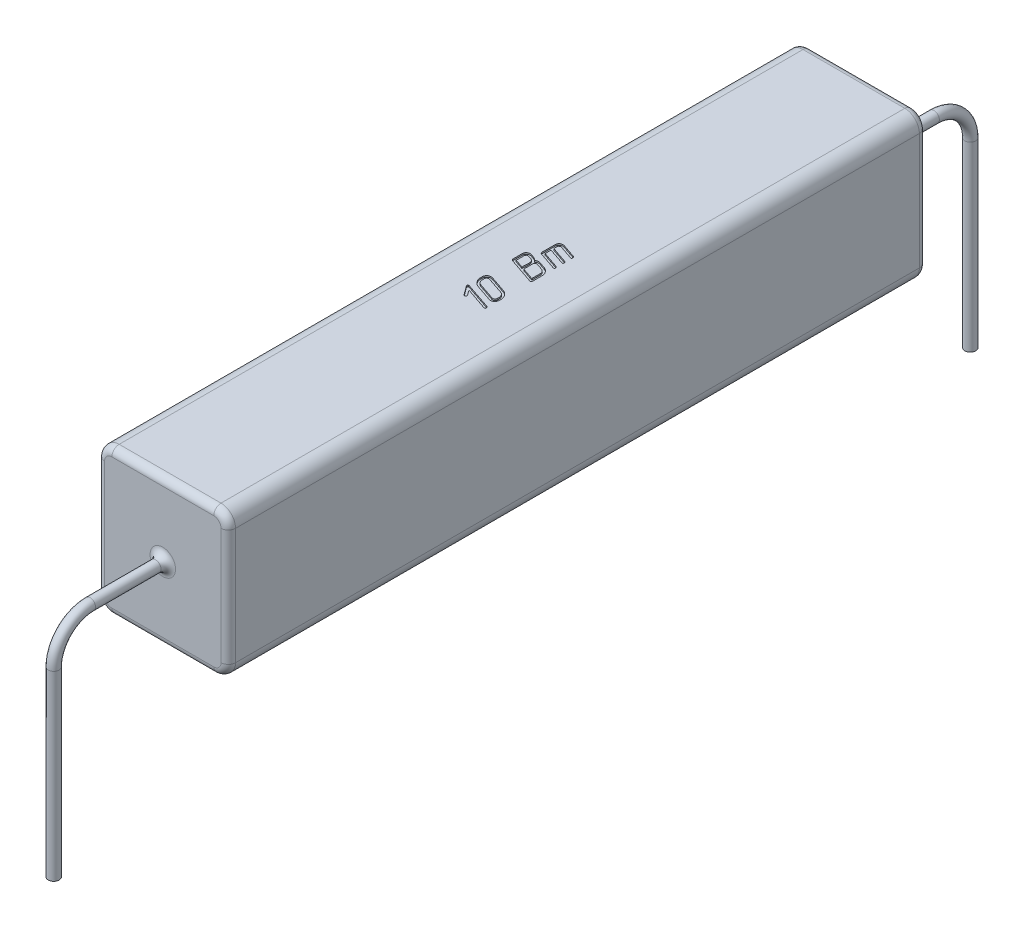
from build123d import *

# Parameters (mm, degrees)
SKETCH_1_W          = 9
SKETCH_1_H          = 10
EXTRUDE_1_DEPTH     = 48
FILLET_1_R          = 1
SWEEP_1_PROFILE_R   = 0.375
SWEEP_2_OUTLINE_R   = 0.375
SWEEP_2_ANGLE       = 90
SWEEP_START         = -5.0000001
SWEEP_2_2_OUTLINE_R = 0.375
SWEEP_2_2_DEPTH     = 6.0000001
SWEEP_START_2       = -15
SWEEP_2_3_OUTLINE_R = 0.375
SWEEP_2_3_DEPTH     = 12.5000001
CUT_EXTRUDE_1_DEPTH = 0.1
FILLET_2_R          = 0.5


with BuildPart() as part:
    # Эскиз1 → Бобышка-Вытянуть1 (new body)
    with BuildSketch(Plane.XY):
        Rectangle(SKETCH_1_W, SKETCH_1_H)
    extrude(amount=EXTRUDE_1_DEPTH)

    # Скругление1
    fillet_1_edges = [part.edges().sort_by_distance(p)[0] for p in [
        (4.5, -5, 24),
        (-4.5, -5, 24),
        (-4.5, 5, 24),
        (4.5, 5, 24),
    ]]
    fillet(fillet_1_edges, radius=FILLET_1_R)

    # По траектории1: sweep along a path in Эскиз4
    with BuildLine(Plane(origin=(0, 0, 0), x_dir=(0, 0, -1), z_dir=(1, 0, 0))) as sweep_1_path:
        Line((-48, 0), (-53, 0))
        ThreePointArc((-53, 0), (-54.767766953, -0.732233047), (-55.5, -2.5))
        Line((-55.5, -2.5), (-55.5, -15))
    # По траектории1 profile (on start of the path) → По траектории1 (sweep)
    with BuildSketch(Plane(origin=(0, 0, 48), x_dir=(0, 1, 0), z_dir=(0, 0, 1))):
        Circle(SWEEP_1_PROFILE_R)
    sweep(path=sweep_1_path.line)



with BuildPart() as body_2:
    # По траектории2: read off the stored shape, not the designer's step
    # По траектории2 outline → По траектории2 (revolve)
    with BuildSketch(Plane(origin=(0, -2.5, -5), x_dir=(0, 0, -1), z_dir=(0, -1, 0))):
        with Locations((2.5, 0)):
            Circle(SWEEP_2_OUTLINE_R)
    revolve(axis=Axis((0, -2.5, -5), (1, 0, 0)), revolution_arc=SWEEP_2_ANGLE)


with BuildPart() as part_1:
    add(part.part)

    add(body_2.part)  # Sweep 2 2 merges body 2
    # Sweep 2 2 outline → Sweep 2 2 (add)
    with BuildSketch(Plane.XY.offset(SWEEP_START)):
        Circle(SWEEP_2_2_OUTLINE_R)
    extrude(amount=SWEEP_2_2_DEPTH)

    # Sweep 2 3 outline → Sweep 2 3 (add)
    with BuildSketch(Plane(origin=(0, 0, 0), x_dir=(1, 0, 0), z_dir=(0, 1, 0)).offset(SWEEP_START_2)):
        with Locations((0, 7.5)):
            Circle(SWEEP_2_3_OUTLINE_R)
    extrude(amount=SWEEP_2_3_DEPTH)

    # Эскиз16 → Вырез-Вытянуть1 (cut)
    # profile 1 of 4: a face of its own
    with BuildSketch(Plane(origin=(0, 5, 0), x_dir=(1, 0, 0), z_dir=(0, 1, 0))):
        with BuildLine():
            add(Edge.make_bspline(
                [(0.900337838, -26.641891892), (0.907900608, -26.644766573), (0.92267343, -26.650381862), (0.942911291, -26.662519398), (0.960712682, -26.677348816), (0.970862609, -26.688908776), (0.975929054, -26.694679054)],
                knots=[0, 0, 0, 0, 1.037447605, 2.026509944, 3.014911145, 4, 4, 4, 4], degree=3))
            add(Edge.make_bspline(
                [(0.975929054, -26.694679054), (0.979641154, -26.700342709), (0.987028144, -26.711613246), (0.994632523, -26.730346311), (0.998840644, -26.750096339), (0.999610605, -26.763494422), (1, -26.77027027)],
                knots=[0, 0, 0, 0, 1.006720306, 2.003349023, 2.990228359, 4, 4, 4, 4], degree=3))
            add(Edge.make_bspline(
                [(1, -26.77027027), (0.999680835, -26.77621904), (0.999069659, -26.78761046), (0.994278361, -26.803592958), (0.986671636, -26.817605106), (0.975432978, -26.828747765), (0.960948777, -26.83693301), (0.942908795, -26.83932684), (0.922149204, -26.838114956), (0.908008123, -26.833554646), (0.900337838, -26.831081081)],
                knots=[0, 0, 0, 0, 0.996926822, 1.909035135, 2.77659255, 3.645436188, 4.533663986, 5.516489295, 6.652915124, 8, 8, 8, 8], degree=3))
            Line((0.900337838, -26.831081081), (-0.65625, -26.301942568))
            Line((-0.65625, -26.301942568), (-0.42652027, -26.622466216))
            add(Edge.make_bspline(
                [(-0.42652027, -26.622466216), (-0.421940504, -26.62924035), (-0.413118282, -26.642289687), (-0.40378834, -26.663258814), (-0.397874642, -26.684217015), (-0.397261384, -26.698302034), (-0.396959459, -26.705236486)],
                knots=[0, 0, 0, 0, 1.096325269, 2.111903722, 3.070436859, 4, 4, 4, 4], degree=3))
            add(Edge.make_bspline(
                [(-0.396959459, -26.705236486), (-0.397178933, -26.711354472), (-0.397608991, -26.723342675), (-0.404184483, -26.740184799), (-0.413476346, -26.755924196), (-0.422349444, -26.764542268), (-0.426942568, -26.769003378)],
                knots=[0, 0, 0, 0, 1.003796091, 1.966940104, 2.947594734, 4, 4, 4, 4], degree=3))
            add(Edge.make_bspline(
                [(-0.426942568, -26.769003378), (-0.432161629, -26.772232719), (-0.44236755, -26.778547723), (-0.459989804, -26.783338537), (-0.478798132, -26.783326395), (-0.491049192, -26.779746662), (-0.497466216, -26.777871622)],
                knots=[0, 0, 0, 0, 0.991254995, 1.938408012, 2.920151812, 4, 4, 4, 4], degree=3))
            add(Edge.make_bspline(
                [(-0.497466216, -26.777871622), (-0.503204384, -26.775541309), (-0.515437552, -26.770573329), (-0.532400612, -26.75837549), (-0.54960726, -26.742875961), (-0.560236498, -26.730701783), (-0.565878378, -26.724239865)],
                knots=[0, 0, 0, 0, 0.842702468, 1.796552709, 2.830434795, 4, 4, 4, 4], degree=3))
            Line((-0.565878378, -26.724239865), (-0.962837838, -26.181587838))
            add(Edge.make_bspline(
                [(-0.962837838, -26.181587838), (-0.96888102, -26.172804049), (-0.980567848, -26.155817199), (-0.995352063, -26.129865268), (-1.00495624, -26.103265854), (-1.006166257, -26.085235029), (-1.006756757, -26.076435811)],
                knots=[0, 0, 0, 0, 1.10421875, 2.135433576, 3.090073427, 4, 4, 4, 4], degree=3))
            add(Edge.make_bspline(
                [(-1.006756757, -26.076435811), (-1.006486551, -26.072272822), (-1.005927399, -26.063658113), (-0.999065843, -26.051627418), (-0.98969888, -26.039511184), (-0.981304944, -26.032500689), (-0.976773649, -26.028716216)],
                knots=[0, 0, 0, 0, 0.848773612, 1.756415427, 2.788846542, 4, 4, 4, 4], degree=3))
            add(Edge.make_bspline(
                [(-0.976773649, -26.028716216), (-0.971202209, -26.026755523), (-0.959347657, -26.022583686), (-0.939073272, -26.021807959), (-0.916396244, -26.024883569), (-0.900978341, -26.029857831), (-0.892736486, -26.032516892)],
                knots=[0, 0, 0, 0, 0.819983227, 1.744708015, 2.79440232, 4, 4, 4, 4], degree=3))
            Line((-0.892736486, -26.032516892), (0.900337838, -26.641891892))
        make_face()
    # profile 2 of 4: a face of its own
    with BuildSketch(Plane(origin=(0, 5, 0), x_dir=(1, 0, 0), z_dir=(0, 1, 0))):
        with BuildLine():
            add(Edge.make_bspline(
                [(0.559966216, -25.147804054), (0.574704359, -25.153192824), (0.604114019, -25.163946003), (0.646632665, -25.184491367), (0.687572415, -25.208720307), (0.727308581, -25.235971459), (0.765018656, -25.267215968), (0.801535979, -25.301513947), (0.836506889, -25.33950307), (0.869377976, -25.380609094), (0.900227722, -25.423125723), (0.926724231, -25.46701609), (0.949206418, -25.511223013), (0.968191139, -25.555488692), (0.981770573, -25.600669691), (0.992765238, -25.645674411), (0.99865592, -25.691426103), (0.999550321, -25.721972998), (1, -25.737331081)],
                knots=[0, 0, 0, 0, 0.965666097, 1.926966875, 2.901998445, 3.892429723, 4.890001312, 5.913841497, 6.97485879, 8.065752039, 9.152782974, 10.206555319, 11.218144994, 12.204777427, 13.16689821, 14.119171752, 15.054374725, 16, 16, 16, 16], degree=3))
            Line((1, -25.737331081), (1, -25.857263514))
            add(Edge.make_bspline(
                [(1, -25.857263514), (0.99958595, -25.871643195), (0.998778557, -25.89968345), (0.99276693, -25.940307637), (0.983223048, -25.978236444), (0.969272527, -26.013259008), (0.950722523, -26.045014437), (0.929242101, -26.074625138), (0.90312201, -26.1009902), (0.873300043, -26.123877481), (0.840851863, -26.143503848), (0.805990776, -26.158283856), (0.769235698, -26.168574938), (0.730624687, -26.17392474), (0.690199008, -26.174891421), (0.648240215, -26.170161424), (0.604279134, -26.161987689), (0.575082401, -26.152642427), (0.559966216, -26.147804054)],
                knots=[0, 0, 0, 0, 1.088837505, 2.123223656, 3.103322986, 4.045756345, 4.967517251, 5.882345664, 6.809701061, 7.767271757, 8.723595112, 9.674195498, 10.626170147, 11.606269477, 12.619391053, 13.68030771, 14.799012954, 16, 16, 16, 16], degree=3))
            Line((0.559966216, -26.147804054), (-0.559966216, -25.767314189))
            add(Edge.make_bspline(
                [(-0.559966216, -25.767314189), (-0.574414867, -25.761900995), (-0.603491603, -25.75100738), (-0.645570382, -25.730649322), (-0.686393072, -25.707017788), (-0.725440412, -25.679164367), (-0.763195305, -25.648058986), (-0.799854335, -25.613606307), (-0.83490851, -25.575437658), (-0.868174486, -25.534235413), (-0.898794764, -25.491081103), (-0.92584131, -25.447267902), (-0.94902458, -25.403076643), (-0.967374146, -25.358466573), (-0.98217714, -25.313651823), (-0.992003888, -25.268478778), (-0.998824851, -25.223037743), (-0.9996082, -25.192592416), (-1, -25.177364865)],
                knots=[0, 0, 0, 0, 0.950065072, 1.911928738, 2.875666774, 3.85246319, 4.862823489, 5.887263183, 6.948901753, 8.052627744, 9.147358374, 10.206266561, 11.222415238, 12.217628648, 13.174672484, 14.125568222, 15.062483245, 16, 16, 16, 16], degree=3))
            Line((-1, -25.177364865), (-1, -25.057432432))
            add(Edge.make_bspline(
                [(-1, -25.057432432), (-0.999573223, -25.043055705), (-0.998741012, -25.015021212), (-0.992900195, -24.974320516), (-0.982720816, -24.936502137), (-0.968751583, -24.90158935), (-0.950957697, -24.869475021), (-0.928610999, -24.840466098), (-0.902320021, -24.814246704), (-0.872404248, -24.791091325), (-0.839652391, -24.771737493), (-0.804736241, -24.756810761), (-0.768097987, -24.746600475), (-0.729645787, -24.741166141), (-0.689491038, -24.740216497), (-0.647683956, -24.745000704), (-0.603979603, -24.753069994), (-0.574939394, -24.762468371), (-0.559966216, -24.767314189)],
                knots=[0, 0, 0, 0, 1.090156082, 2.125794869, 3.109806331, 4.053380972, 4.97099529, 5.884814069, 6.820810161, 7.779540469, 8.746201641, 9.697953199, 10.651080684, 11.621800386, 12.636148847, 13.687729875, 14.807789865, 16, 16, 16, 16], degree=3))
            Line((-0.559966216, -24.767314189), (0.559966216, -25.147804054))
        make_face()
        with BuildLine():
            Line((0.567567568, -25.339527027), (-0.567567568, -24.953547297))
            add(Edge.make_bspline(
                [(-0.567567568, -24.953547297), (-0.583475047, -24.948925187), (-0.613756989, -24.940126404), (-0.65982231, -24.93810001), (-0.702291386, -24.947226562), (-0.740367202, -24.965876671), (-0.771944548, -24.993515454), (-0.795369246, -25.029145196), (-0.808322993, -25.072489694), (-0.809950069, -25.10351806), (-0.810810811, -25.119932432)],
                knots=[0, 0, 0, 0, 1.119951569, 2.131972502, 3.088174406, 4.035386015, 4.975072295, 5.898588306, 6.888328318, 8, 8, 8, 8], degree=3))
            Line((-0.810810811, -25.119932432), (-0.810810811, -25.244087838))
            add(Edge.make_bspline(
                [(-0.810810811, -25.244087838), (-0.809830441, -25.261056174), (-0.807849619, -25.295340432), (-0.794163216, -25.346406011), (-0.771271368, -25.396395297), (-0.740822805, -25.44476662), (-0.70399891, -25.488664229), (-0.662657079, -25.526215642), (-0.617048675, -25.555512249), (-0.584000989, -25.568640643), (-0.567567568, -25.575168919)],
                knots=[0, 0, 0, 0, 0.935241619, 1.889641067, 2.893591954, 3.957321353, 5.031531652, 6.042805618, 7.026757895, 8, 8, 8, 8], degree=3))
            Line((-0.567567568, -25.575168919), (0.567567568, -25.961148649))
            add(Edge.make_bspline(
                [(0.567567568, -25.961148649), (0.583479057, -25.965785046), (0.613768634, -25.974611027), (0.659613503, -25.976445098), (0.702166919, -25.96804844), (0.739837519, -25.948709372), (0.771646472, -25.921060473), (0.795226039, -25.885427889), (0.808340615, -25.842223613), (0.809955992, -25.811463377), (0.810810811, -25.795185811)],
                knots=[0, 0, 0, 0, 1.121692947, 2.13528744, 3.081659146, 4.034616812, 4.975764181, 5.913947912, 6.896112182, 8, 8, 8, 8], degree=3))
            Line((0.810810811, -25.795185811), (0.810810811, -25.671030405))
            add(Edge.make_bspline(
                [(0.810810811, -25.671030405), (0.810014539, -25.654195914), (0.808404762, -25.620162572), (0.794469445, -25.569644418), (0.772094528, -25.519883446), (0.742043735, -25.471808376), (0.706021912, -25.427281543), (0.664168562, -25.389871419), (0.618285812, -25.359323008), (0.584467006, -25.346123094), (0.567567568, -25.339527027)],
                knots=[0, 0, 0, 0, 0.925659353, 1.871353331, 2.863795989, 3.922072503, 4.985022592, 6.005964217, 7.003569671, 8, 8, 8, 8], degree=3))
        make_face(mode=Mode.SUBTRACT)
    # profile 3 of 4: a face of its own
    with BuildSketch(Plane(origin=(0, 5, 0), x_dir=(1, 0, 0), z_dir=(0, 1, 0))):
        with BuildLine():
            add(Edge.make_bspline(
                [(-0.161317568, -22.290962838), (-0.15218809, -22.280353716), (-0.134033047, -22.259256225), (-0.098687439, -22.235888393), (-0.058592738, -22.219727795), (-0.013946518, -22.21062975), (0.033804256, -22.208675961), (0.083690665, -22.211449854), (0.134989751, -22.220868202), (0.168877043, -22.231475858), (0.186233108, -22.236908784)],
                knots=[0, 0, 0, 0, 0.892051377, 1.773949364, 2.678868507, 3.645182869, 4.673448156, 5.729198898, 6.836963111, 8, 8, 8, 8], degree=3))
            Line((0.186233108, -22.236908784), (0.592905405, -22.375))
            add(Edge.make_bspline(
                [(0.592905405, -22.375), (0.606650619, -22.379981805), (0.63419387, -22.389964562), (0.673920239, -22.409058128), (0.711842008, -22.431753666), (0.748907351, -22.456480193), (0.78402677, -22.485104916), (0.817764603, -22.516701894), (0.849898318, -22.551569619), (0.880379974, -22.588768407), (0.908598557, -22.627431266), (0.93252031, -22.667393146), (0.953425285, -22.707021443), (0.970568594, -22.74706474), (0.983643369, -22.787519736), (0.992784976, -22.828248895), (0.999263264, -22.869021967), (0.999754365, -22.896371294), (1, -22.910050676)],
                knots=[0, 0, 0, 0, 0.984621191, 1.973026332, 2.963613186, 3.960581206, 4.972237654, 6.012259905, 7.0726242, 8.164336059, 9.251424099, 10.294037773, 11.299406285, 12.268279889, 13.225055236, 14.159139285, 15.079252034, 16, 16, 16, 16], degree=3))
            Line((1, -22.910050676), (1, -23.603462838))
            add(Edge.make_bspline(
                [(1, -23.603462838), (0.999706326, -23.611094171), (0.999166672, -23.625117488), (0.994634262, -23.644141517), (0.987110794, -23.659399546), (0.975427089, -23.670309517), (0.960379561, -23.676010999), (0.942685018, -23.678236399), (0.922098243, -23.675006899), (0.907741786, -23.670793503), (0.899915541, -23.668496622)],
                knots=[0, 0, 0, 0, 1.214130512, 2.231082703, 3.093692225, 3.887080093, 4.711544167, 5.615422702, 6.700076944, 8, 8, 8, 8], degree=3))
            Line((0.899915541, -23.668496622), (-0.899915541, -23.057010135))
            add(Edge.make_bspline(
                [(-0.899915541, -23.057010135), (-0.907873678, -23.053955078), (-0.923071349, -23.04812083), (-0.943893006, -23.036776555), (-0.960974539, -23.022385957), (-0.975451903, -23.006488399), (-0.986763901, -22.988365547), (-0.994351726, -22.967966126), (-0.998997715, -22.945591418), (-0.999659932, -22.929921801), (-1, -22.921875)],
                knots=[0, 0, 0, 0, 1.127747119, 2.153661085, 3.11964554, 4.069509502, 4.989682849, 5.927228302, 6.935571904, 8, 8, 8, 8], degree=3))
            Line((-1, -22.921875), (-1, -22.317567568))
            add(Edge.make_bspline(
                [(-1, -22.317567568), (-0.999734745, -22.304032586), (-0.99921845, -22.277687985), (-0.993531543, -22.239638673), (-0.984806703, -22.204151374), (-0.972217253, -22.17161028), (-0.955848191, -22.142061689), (-0.93643742, -22.115087287), (-0.912749158, -22.091296058), (-0.886027643, -22.070265347), (-0.856431427, -22.053231146), (-0.825593279, -22.039294467), (-0.792908072, -22.030592005), (-0.758924583, -22.025387956), (-0.72330693, -22.024628626), (-0.68642584, -22.028300641), (-0.647959212, -22.035251363), (-0.622526484, -22.04346978), (-0.609375, -22.047719595)],
                knots=[0, 0, 0, 0, 1.135910498, 2.210945764, 3.22310351, 4.200058986, 5.13131075, 6.053513699, 6.98145781, 7.941602178, 8.90065419, 9.842946492, 10.775098306, 11.731450505, 12.724791973, 13.757657652, 14.840465296, 16, 16, 16, 16], degree=3))
            Line((-0.609375, -22.047719595), (-0.413851351, -22.11402027))
            add(Edge.make_bspline(
                [(-0.413851351, -22.11402027), (-0.391606523, -22.122704262), (-0.346343387, -22.140374199), (-0.293536446, -22.172276893), (-0.252150605, -22.202202668), (-0.221350217, -22.228727248), (-0.19040458, -22.258010595), (-0.171147964, -22.279826129), (-0.161317568, -22.290962838)],
                knots=[0, 0, 0, 0, 1.375898188, 2.799638002, 3.543750545, 4.321718278, 5.14324648, 6, 6, 6, 6], degree=3))
        make_face()
        with BuildLine():
            Line((-0.027027027, -23.164273649), (0.810810811, -23.449324324))
            Line((0.810810811, -23.449324324), (0.810810811, -22.841216216))
            add(Edge.make_bspline(
                [(0.810810811, -22.841216216), (0.809999429, -22.82722264), (0.808370449, -22.799128276), (0.797456949, -22.757236419), (0.778311728, -22.716699793), (0.753178121, -22.67727214), (0.722419691, -22.640938028), (0.686622202, -22.60955871), (0.645898821, -22.58472459), (0.616328587, -22.573055586), (0.601351351, -22.56714527)],
                knots=[0, 0, 0, 0, 0.916476355, 1.839974204, 2.813562221, 3.841671305, 4.894653146, 5.920651928, 6.946816381, 8, 8, 8, 8], degree=3))
            Line((0.601351351, -22.56714527), (0.182432432, -22.424831081))
            add(Edge.make_bspline(
                [(0.182432432, -22.424831081), (0.168476942, -22.42060506), (0.141934351, -22.412567396), (0.102006374, -22.409852487), (0.065253743, -22.415617938), (0.032925075, -22.430211447), (0.005521824, -22.451668041), (-0.013542045, -22.481136261), (-0.025314139, -22.516593407), (-0.026431542, -22.542408293), (-0.027027027, -22.556165541)],
                knots=[0, 0, 0, 0, 1.167327774, 2.220194613, 3.182288453, 4.12291626, 5.038654227, 5.934808734, 6.899419934, 8, 8, 8, 8], degree=3))
            Line((-0.027027027, -22.556165541), (-0.027027027, -23.164273649))
        make_face(mode=Mode.SUBTRACT)
        with BuildLine():
            add(Edge.make_bspline(
                [(-0.197212838, -22.585726351), (-0.197774795, -22.57128846), (-0.198898952, -22.542406472), (-0.210909943, -22.499935501), (-0.228617388, -22.458150516), (-0.253525321, -22.418243301), (-0.283434116, -22.381118021), (-0.318639824, -22.349729756), (-0.358172281, -22.324515574), (-0.38702536, -22.313166888), (-0.40160473, -22.307432432)],
                knots=[0, 0, 0, 0, 0.942204393, 1.884813734, 2.866686695, 3.904367605, 4.951445375, 5.975469829, 6.977011274, 8, 8, 8, 8], degree=3))
            Line((-0.40160473, -22.307432432), (-0.606418919, -22.237753378))
            add(Edge.make_bspline(
                [(-0.606418919, -22.237753378), (-0.620102083, -22.23385901), (-0.646009556, -22.226485477), (-0.684976773, -22.223863473), (-0.720748308, -22.230755527), (-0.752461939, -22.246076292), (-0.778738964, -22.26924245), (-0.797890337, -22.299508404), (-0.808929859, -22.336403395), (-0.810156744, -22.362955982), (-0.810810811, -22.377111486)],
                knots=[0, 0, 0, 0, 1.139243321, 2.157024198, 3.10036868, 4.029551298, 4.949425652, 5.873448589, 6.866309756, 8, 8, 8, 8], degree=3))
            Line((-0.810810811, -22.377111486), (-0.810810811, -22.898226351))
            Line((-0.810810811, -22.898226351), (-0.216216216, -23.100084459))
            Line((-0.216216216, -23.100084459), (-0.197212838, -22.585726351))
        make_face(mode=Mode.SUBTRACT)
    # profile 4 of 4: a face of its own
    with BuildSketch(Plane(origin=(0, 5, 0), x_dir=(1, 0, 0), z_dir=(0, 1, 0))):
        with BuildLine():
            Line((-0.216216216, -21.100084459), (-0.216216216, -21.505489865))
            Line((-0.216216216, -21.505489865), (0.898648649, -21.884290541))
            add(Edge.make_bspline(
                [(0.898648649, -21.884290541), (0.906381244, -21.887118076), (0.921550811, -21.892665047), (0.94174849, -21.905469679), (0.960546002, -21.919578667), (0.970507499, -21.931511442), (0.975506757, -21.9375)],
                knots=[0, 0, 0, 0, 1.039225572, 2.038720723, 3.015716316, 4, 4, 4, 4], degree=3))
            add(Edge.make_bspline(
                [(0.975506757, -21.9375), (0.979145552, -21.943337409), (0.986284167, -21.954789281), (0.994926328, -21.973275617), (0.998745113, -21.993231847), (0.999581373, -22.006747605), (1, -22.013513514)],
                knots=[0, 0, 0, 0, 1.017714773, 1.996560254, 2.99708992, 4, 4, 4, 4], degree=3))
            add(Edge.make_bspline(
                [(1, -22.013513514), (0.999669649, -22.019455723), (0.999037054, -22.030834579), (0.994373794, -22.046972215), (0.986180866, -22.060726686), (0.97504254, -22.072017329), (0.960519136, -22.080140919), (0.942468541, -22.082705373), (0.921620233, -22.080718464), (0.907309688, -22.07630996), (0.899493243, -22.073902027)],
                knots=[0, 0, 0, 0, 0.992416902, 1.900398999, 2.77580403, 3.640717174, 4.524926786, 5.503305968, 6.63630136, 8, 8, 8, 8], degree=3))
            Line((0.899493243, -22.073902027), (-0.304898649, -21.664695946))
            add(Edge.make_bspline(
                [(-0.304898649, -21.664695946), (-0.312872354, -21.661659648), (-0.328099756, -21.655861222), (-0.348736716, -21.644260889), (-0.366385565, -21.630831563), (-0.380452141, -21.614681702), (-0.392154679, -21.597142847), (-0.399672806, -21.577041419), (-0.404452547, -21.555266149), (-0.405080119, -21.540004893), (-0.405405405, -21.532094595)],
                knots=[0, 0, 0, 0, 1.139987296, 2.177036178, 3.156405863, 4.08999107, 5.030199544, 5.960360135, 6.942802502, 8, 8, 8, 8], degree=3))
            Line((-0.405405405, -21.532094595), (-0.405405405, -20.646114865))
            add(Edge.make_bspline(
                [(-0.405405405, -20.646114865), (-0.405125431, -20.633146292), (-0.404581018, -20.607928772), (-0.399105479, -20.571462079), (-0.389579629, -20.537695237), (-0.377181963, -20.506258714), (-0.360402434, -20.477608904), (-0.340089325, -20.45173431), (-0.315910764, -20.428647214), (-0.288745391, -20.408164525), (-0.258895016, -20.390829803), (-0.226938548, -20.377624454), (-0.193415569, -20.368766195), (-0.158375543, -20.364099515), (-0.121802223, -20.363771389), (-0.083611722, -20.36775071), (-0.04382993, -20.375701015), (-0.01738261, -20.38416623), (-0.003800676, -20.388513514)],
                knots=[0, 0, 0, 0, 1.086188582, 2.112104511, 3.079387279, 4.02123667, 4.935654199, 5.851212137, 6.76881924, 7.728955834, 8.696022828, 9.653256947, 10.617442329, 11.593316971, 12.607777412, 13.674644955, 14.805821523, 16, 16, 16, 16], degree=3))
            Line((-0.003800676, -20.388513514), (0.899493243, -20.695523649))
            add(Edge.make_bspline(
                [(0.899493243, -20.695523649), (0.907042012, -20.698422352), (0.921900805, -20.704128083), (0.942430389, -20.716013334), (0.960281733, -20.730995379), (0.970437431, -20.742545462), (0.975506757, -20.748310811)],
                knots=[0, 0, 0, 0, 1.033423927, 2.034164005, 3.018731752, 4, 4, 4, 4], degree=3))
            add(Edge.make_bspline(
                [(0.975506757, -20.748310811), (0.979145552, -20.75414822), (0.986284167, -20.765600092), (0.994926328, -20.784086428), (0.998745113, -20.804042658), (0.999581373, -20.817558416), (1, -20.824324324)],
                knots=[0, 0, 0, 0, 1.017714773, 1.996560254, 2.99708992, 4, 4, 4, 4], degree=3))
            add(Edge.make_bspline(
                [(1, -20.824324324), (0.999669499, -20.830266415), (0.999036615, -20.841645044), (0.994375357, -20.857784257), (0.986175252, -20.871533075), (0.974975715, -20.882933908), (0.96021972, -20.890981139), (0.941870094, -20.892941105), (0.920915043, -20.891202207), (0.906466861, -20.886717376), (0.898648649, -20.884290541)],
                knots=[0, 0, 0, 0, 0.9874205, 1.890831288, 2.761829021, 3.62238769, 4.522761795, 5.492550866, 6.64316701, 8, 8, 8, 8], degree=3))
            Line((0.898648649, -20.884290541), (-0.013513514, -20.574324324))
            add(Edge.make_bspline(
                [(-0.013513514, -20.574324324), (-0.027056434, -20.570415683), (-0.052680623, -20.563020248), (-0.09132605, -20.560569978), (-0.126752503, -20.566861759), (-0.158275154, -20.581448689), (-0.184419927, -20.603470235), (-0.203323836, -20.632857042), (-0.214308911, -20.668592288), (-0.215554657, -20.694456992), (-0.216216216, -20.708192568)],
                knots=[0, 0, 0, 0, 1.149680738, 2.17527953, 3.134380601, 4.060907881, 4.983139029, 5.889443481, 6.879178827, 8, 8, 8, 8], degree=3))
            Line((-0.216216216, -20.708192568), (-0.216216216, -20.91089527))
            Line((-0.216216216, -20.91089527), (0.898648649, -21.289695946))
            add(Edge.make_bspline(
                [(0.898648649, -21.289695946), (0.906381244, -21.292523481), (0.921550811, -21.298070452), (0.94174849, -21.310875084), (0.960546002, -21.324984072), (0.970507499, -21.336916847), (0.975506757, -21.342905405)],
                knots=[0, 0, 0, 0, 1.039225572, 2.038720723, 3.015716316, 4, 4, 4, 4], degree=3))
            add(Edge.make_bspline(
                [(0.975506757, -21.342905405), (0.979145552, -21.348742815), (0.986284167, -21.360194687), (0.994926328, -21.378681022), (0.998745113, -21.398637252), (0.999581373, -21.41215301), (1, -21.418918919)],
                knots=[0, 0, 0, 0, 1.017714773, 1.996560254, 2.99708992, 4, 4, 4, 4], degree=3))
            add(Edge.make_bspline(
                [(1, -21.418918919), (0.999669499, -21.42486101), (0.999036615, -21.436239638), (0.994375357, -21.452378852), (0.986175252, -21.466127669), (0.974975715, -21.477528503), (0.96021972, -21.485575734), (0.941870094, -21.4875357), (0.920915043, -21.485796802), (0.906466861, -21.481311971), (0.898648649, -21.478885135)],
                knots=[0, 0, 0, 0, 0.9874205, 1.890831288, 2.761829021, 3.62238769, 4.522761795, 5.492550866, 6.64316701, 8, 8, 8, 8], degree=3))
            Line((0.898648649, -21.478885135), (-0.216216216, -21.100084459))
        make_face()
    extrude(amount=-CUT_EXTRUDE_1_DEPTH, mode=Mode.SUBTRACT)

    # Скругление2
    fillet_2_edges = [part_1.edges().sort_by_distance(p)[0] for p in [
        (0, -5, 0),
        (0, -5, 48),
        (4.5, 0, 0),
        (-4.5, 0, 0),
        (0, 5, 0),
        (4.207106781, 4.707106781, 0),
        (4.207106781, -4.707106781, 0),
        (-4.207106781, 4.707106781, 0),
        (-4.207106781, -4.707106781, 0),
        (-4.5, 0, 48),
        (4.5, 0, 48),
        (0, 5, 48),
        (4.207106781, 4.707106781, 48),
        (4.207106781, -4.707106781, 48),
        (-4.207106781, 4.707106781, 48),
        (-4.207106781, -4.707106781, 48),
        (0, -0.375, 48),
        (-0.375, 0, 0),
    ]]
    fillet(fillet_2_edges, radius=FILLET_2_R)


solid = part_1.part
